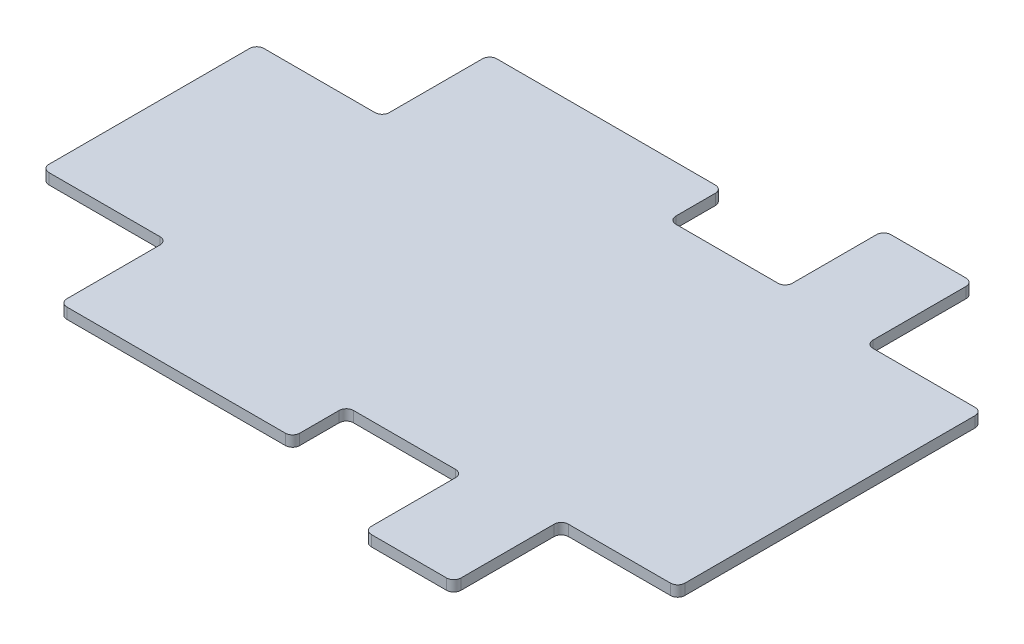
from build123d import *

# Parameters (mm, degrees)
SALIENTE_EXTRUIR1_DEPTH = 6
REDONDEO1_R             = 4


with BuildPart() as part:
    # Croquis1 → Saliente-Extruir1 (new body)
    with BuildSketch(Plane(origin=(0, 0, 0), x_dir=(1, 0, 0), z_dir=(0, 1, 0))):
        Polygon((0, 0), (-380, 0), (-380, 60), (-310, 60), (-310, 120), (-180, 120), (-180, 90), (-115, 90), (-115, 145), (-65, 145), (-65, 85), (0, 85), align=None)
    saliente_extruir1 = extrude(amount=SALIENTE_EXTRUIR1_DEPTH)

    # Simetría1: Saliente-Extruir1 across plane
    add(saliente_extruir1.mirror(Plane(origin=(0, 6, 0), x_dir=(1, 0, 0), z_dir=(0, 0, -1))))

    # Redondeo1
    redondeo1_edges = [part.edges().sort_by_distance(p)[0] for p in [
        (-380, 3, -60),
        (-310, 3, -60),
        (-310, 3, -120),
        (-180, 3, -120),
        (-180, 3, -90),
        (-115, 3, -90),
        (-115, 3, -145),
        (-65, 3, -85),
        (-65, 3, -145),
        (0, 3, -85),
        (0, 3, 85),
        (-65, 3, 85),
        (-65, 3, 145),
        (-115, 3, 145),
        (-115, 3, 90),
        (-180, 3, 90),
        (-180, 3, 120),
        (-310, 3, 120),
        (-310, 3, 60),
        (-380, 3, 60),
    ]]
    fillet(redondeo1_edges, radius=REDONDEO1_R)


solid = part.part
